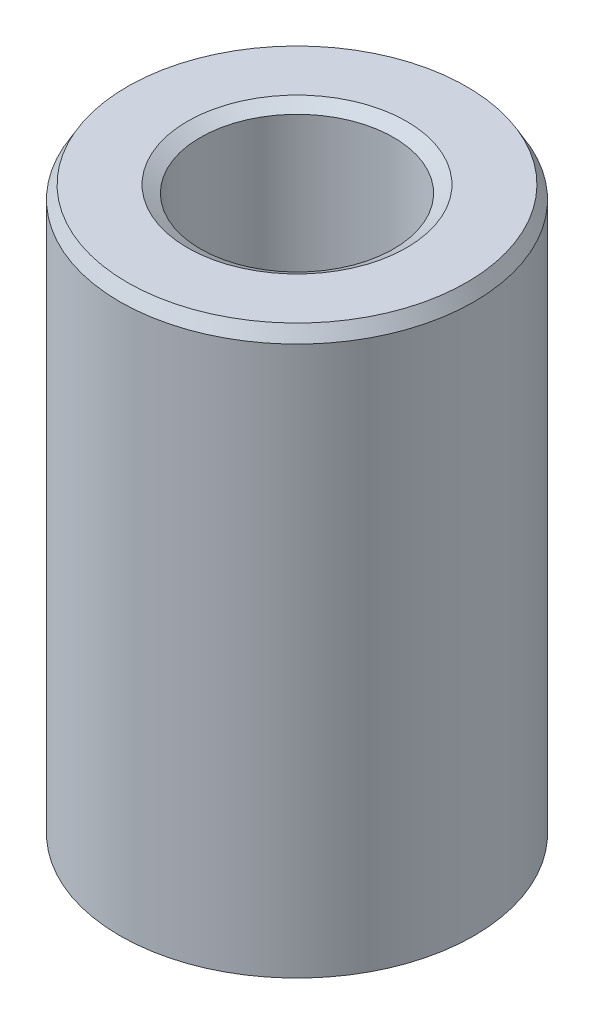
from build123d import *
from OCP.BRepFilletAPI import BRepFilletAPI_MakeChamfer

# Parameters (mm, degrees)
SKETCH1_R           = 5
BOSS_EXTRUDE1_DEPTH = 16.073745974
SKETCH2_R           = 2.727096619
CUT_EXTRUDE1_DEPTH  = 18.560333415
CHAMFER1_SIZE       = 0.365868298
CHAMFER1_SIZE2      = 0.21123416


with BuildPart() as part:
    # Sketch1 → Boss-Extrude1 (new body)
    with BuildSketch(Plane(origin=(0, 0, 0), x_dir=(1, 0, 0), z_dir=(0, 1, 0))):
        Circle(SKETCH1_R)
    extrude(amount=BOSS_EXTRUDE1_DEPTH)

    # Sketch2 → Cut-Extrude1 (cut, through all)
    with BuildSketch(Plane(origin=(0, 0, 0), x_dir=(1, 0, 0), z_dir=(0, 1, 0))):
        Circle(SKETCH2_R)
    extrude(amount=CUT_EXTRUDE1_DEPTH, mode=Mode.SUBTRACT)

    # Chamfer1: one chamfer whose edges measure the first distance from different faces: ONE call of the kernel's chamfer builder (chamfer() names one face for all edges)
    chamfer1_edges_1 = [part.edges().sort_by_distance(p)[0] for p in [
        (-2.727096619, 16.073745974, 0),
    ]]
    chamfer1_side_1 = [part.faces().sort_by_distance(p)[0] for p in [
        (-4.858578644, 16.073745974, 0),
    ]]
    chamfer1_edges_2 = [part.edges().sort_by_distance(p)[0] for p in [
        (-2.727096619, 0, 0),
    ]]
    chamfer1_side_2 = [part.faces().sort_by_distance(p)[0] for p in [
        (-2.727096619, 8.036872987, 0),
    ]]
    chamfer1_edges_3 = [part.edges().sort_by_distance(p)[0] for p in [
        (-5, 0, 0),
    ]]
    chamfer1_side_3 = [part.faces().sort_by_distance(p)[0] for p in [
        (-4.858578644, 0, 0),
    ]]
    chamfer1_edges_4 = [part.edges().sort_by_distance(p)[0] for p in [
        (-5, 16.073745974, 0),
    ]]
    chamfer1_side_4 = [part.faces().sort_by_distance(p)[0] for p in [
        (-5, 8.036872987, 0),
    ]]
    chamfer1 = BRepFilletAPI_MakeChamfer(part.part.solid().wrapped)
    for e in chamfer1_edges_1:
        chamfer1.Add(CHAMFER1_SIZE, CHAMFER1_SIZE2, e.wrapped, chamfer1_side_1[0].wrapped)  # the first distance lies on this face
    for e in chamfer1_edges_2:
        chamfer1.Add(CHAMFER1_SIZE, CHAMFER1_SIZE2, e.wrapped, chamfer1_side_2[0].wrapped)  # the first distance lies on this face
    for e in chamfer1_edges_3:
        chamfer1.Add(CHAMFER1_SIZE, CHAMFER1_SIZE2, e.wrapped, chamfer1_side_3[0].wrapped)  # the first distance lies on this face
    for e in chamfer1_edges_4:
        chamfer1.Add(CHAMFER1_SIZE, CHAMFER1_SIZE2, e.wrapped, chamfer1_side_4[0].wrapped)  # the first distance lies on this face
    add(Compound.cast(chamfer1.Shape()), mode=Mode.REPLACE)


solid = part.part
